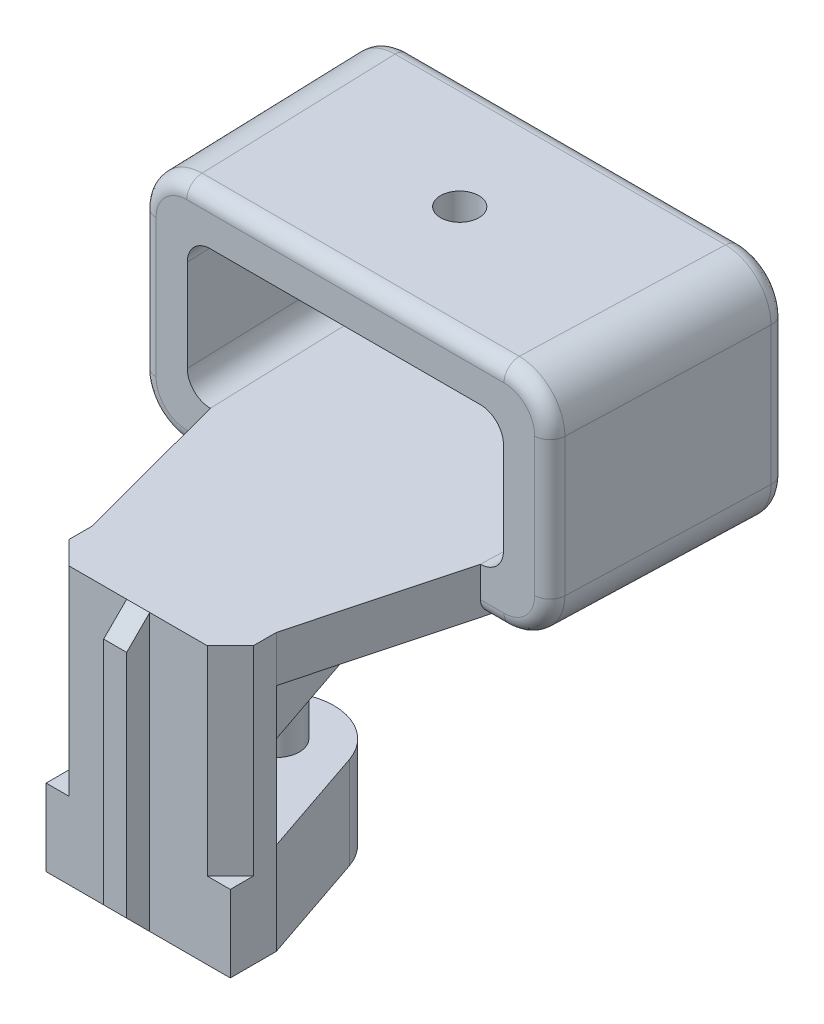
from build123d import *

# Parameters (mm, degrees)
SKETCH_1_R          = 3
EXTRUDE_1_DEPTH     = 12
SKETCH_2_W          = 24
SKETCH_2_H          = 6
EXTRUDE_2_DEPTH     = 36
EXTRUDE_START       = -12
SKETCH_3_R          = 3
EXTRUDE_3_DEPTH     = 12
EXTRUDE_START_2     = -6
SKETCH_5_R          = 3
EXTRUDE_5_DEPTH     = 6
EXTRUDE_7_DEPTH     = 30
EXTRUDE_8_DEPTH     = 3
SKETCH_10_R         = 2.5
EXTRUDE_9_DEPTH     = 6
FILLET_1_R          = 3
FILLET_2_R          = 6
SKETCH_11_W         = 3
SKETCH_11_H         = 12
EXTRUDE_10_DEPTH    = 1.5
SKETCH_12_W         = 73.854631002
SKETCH_12_H         = 4.710162055
CUT_EXTRUDE_1_DEPTH = 13
CUT_EXTRUDE_2_DEPTH = 13
FILLET_3_R          = 2
CHAMFER_1_SIZE      = 3
SKETCH_2_2_W        = 24
SKETCH_2_2_H        = 6
EXTRUDE_11_DEPTH    = 10
EXTRUDE_START_3     = -36
SKETCH_3_2_R        = 3
EXTRUDE_12_DEPTH    = 36


with BuildPart() as part:
    # 스케치1 → 보스-돌출1 (new body)
    with BuildSketch(Plane(origin=(0, 0, 0), x_dir=(1, 0, 0), z_dir=(0, 1, 0))):
        with BuildLine():
            Line((-12, -12), (12, -12))
            Line((12, -12), (7.101042921, 2.413542921))
            ThreePointArc((7.101042921, 2.413542921), (0, 7.5), (-7.101042921, 2.413542921))
            Line((-7.101042921, 2.413542921), (-12, -12))
        make_face()
        Circle(SKETCH_1_R, mode=Mode.SUBTRACT)
    extrude(amount=EXTRUDE_1_DEPTH)

    # 스케치2 → 보스-돌출2 (add)
    with BuildSketch(Plane(origin=(0, 0, 0), x_dir=(1, 0, 0), z_dir=(0, 1, 0))):
        with Locations((0, -15)):
            Rectangle(SKETCH_2_W, SKETCH_2_H)
    extrude(amount=EXTRUDE_2_DEPTH)

    # 스케치3 → 보스-돌출3 (add)
    with BuildSketch(Plane(origin=(0, 36, 0), x_dir=(1, 0, 0), z_dir=(0, 1, 0)).offset(EXTRUDE_START)):
        with BuildLine():
            Line((-7.101042921, 2.413542921), (-12, -12))
            Line((-12, -12), (12, -12))
            Line((12, -12), (7.101042921, 2.413542921))
            ThreePointArc((7.101042921, 2.413542921), (0, 7.5), (-7.101042921, 2.413542921))
        make_face()
        Circle(SKETCH_3_R, mode=Mode.SUBTRACT)
    extrude(amount=EXTRUDE_3_DEPTH)

    # 스케치5 → 보스-돌출5 (add)
    with BuildSketch(Plane(origin=(0, 36, 0), x_dir=(1, 0, 0), z_dir=(0, 1, 0)).offset(EXTRUDE_START_2)):
        Polygon((20.6, 9), (21.6, 39), (-21.6, 39), (-20.6, 9), (-12, -12), (12, -12), align=None)
        Circle(SKETCH_5_R, mode=Mode.SUBTRACT)
    extrude(amount=EXTRUDE_5_DEPTH)

    # 스케치8 → 보스-돌출7 (add)
    with BuildSketch(Plane.XZ.offset(-30)):
        Polygon((-27.603332408, -39), (-21.6, -39), (-20.6, -9), (-26.603332408, -9), align=None)
        Polygon((20.6, -9), (26.603332408, -9), (27.603332408, -39), (21.6, -39), align=None)
    extrude(amount=-EXTRUDE_7_DEPTH)

    # 스케치9 → 보스-돌출8 (add, symmetric)
    with BuildSketch(Plane(origin=(0, 0, 0), x_dir=(0, 0, -1), z_dir=(1, 0, 0))):
        Polygon((33.7, 30), (6.7, 25), (6.7, 30), align=None)
    extrude(amount=EXTRUDE_8_DEPTH, both=True)

    # 스케치10 → 보스-돌출9 (add)
    with BuildSketch(Plane(origin=(0, 60, 0), x_dir=(1, 0, 0), z_dir=(0, 1, 0))):
        Polygon((20.6, 9), (21.6, 39), (-21.7, 39), (-20.6, 9), align=None)
        with Locations((-0.101268067, 24)):
            Circle(SKETCH_10_R, mode=Mode.SUBTRACT)
    extrude(amount=-EXTRUDE_9_DEPTH)

    # 필렛1
    fillet_1_edges = [part.edges().sort_by_distance(p)[0] for p in [
        (-21.1, 54, -24),
        (-21.1, 36, -24),
        (21.1, 36, -24),
        (21.1, 54, -24),
    ]]
    fillet(fillet_1_edges, radius=FILLET_1_R)

    # 필렛2
    fillet_2_edges = [part.edges().sort_by_distance(p)[0] for p in [
        (-27.103332408, 60, -24),
        (-27.103332408, 30, -24),
        (27.103332408, 30, -24),
        (27.103332408, 60, -24),
    ]]
    fillet(fillet_2_edges, radius=FILLET_2_R)

    # 스케치11 → 보스-돌출10 (add, symmetric)
    with BuildSketch(Plane(origin=(0, 0, 0), x_dir=(0, 0, -1), z_dir=(1, 0, 0))):
        with Locations((-10.5, 18)):
            Rectangle(SKETCH_11_W, SKETCH_11_H)
        Polygon((-18, 36), (-18, 0), (-21, 3), (-21, 33), align=None)
    extrude(amount=EXTRUDE_10_DEPTH, both=True)

    # 스케치12 → 컷-돌출1 (cut)
    with BuildSketch(Plane.XY.offset(-9)):
        with Locations((-1.11650338, 38.355081028)):
            Rectangle(SKETCH_12_W, SKETCH_12_H)
    extrude(amount=CUT_EXTRUDE_1_DEPTH, mode=Mode.SUBTRACT)

    # 스케치13 → 컷-돌출2 (cut)
    with BuildSketch(Plane(origin=(0, 36, 0), x_dir=(1, 0, 0), z_dir=(0, 1, 0))):
        Polygon((-17.598333796, 9), (-12, -12), (-14.220944906, -12), (-22.942076864, 9), align=None)
        Polygon((17.598333796, 9), (12, -12), (13.749532367, -12), (23.601666204, 9), align=None)
    extrude(amount=-CUT_EXTRUDE_2_DEPTH, mode=Mode.SUBTRACT)

    # 필렛3
    fillet_3_edges = [part.edges().sort_by_distance(p)[0] for p in [
        (19.099166898, 30, -9),
        (25.798857897, 32.999687603, -9),
        (26.603332408, 45, -9),
        (24.844407759, 58.243229575, -9),
        (-19.099166898, 30, -9),
        (-25.604752315, 32.686353371, -9),
        (-26.603332408, 45, -9),
        (-24.844407759, 58.243229575, -9),
        (-25.844407759, 58.243229575, -39),
        (-27.603332408, 45, -39),
        (-25.844407759, 31.756770425, -39),
        (0, 30, -39),
        (25.844407759, 31.756770425, -39),
        (27.603332408, 45, -39),
        (25.844407759, 58.243229575, -39),
        (0, 60, -9),
        (0, 60, -39),
    ]]
    fillet(fillet_3_edges, radius=FILLET_3_R)

    # 모따기1
    chamfer_1_edges = [part.edges().sort_by_distance(p)[0] for p in [
        (12, 18, 18),
        (-12, 18, 18),
    ]]
    chamfer(chamfer_1_edges, length=CHAMFER_1_SIZE)

    # 스케치2<2> → 보스-돌출11 (add)
    with BuildSketch(Plane(origin=(0, 0, 0), x_dir=(1, 0, 0), z_dir=(0, 1, 0))):
        with Locations((0, -15)):
            Rectangle(SKETCH_2_2_W, SKETCH_2_2_H)
    extrude(amount=EXTRUDE_11_DEPTH)

    # 스케치3<2> → 보스-돌출12 (add)
    with BuildSketch(Plane(origin=(0, 36, 0), x_dir=(1, 0, 0), z_dir=(0, 1, 0)).offset(EXTRUDE_START_3)):
        Circle(SKETCH_3_2_R)
    extrude(amount=EXTRUDE_12_DEPTH)


solid = part.part
